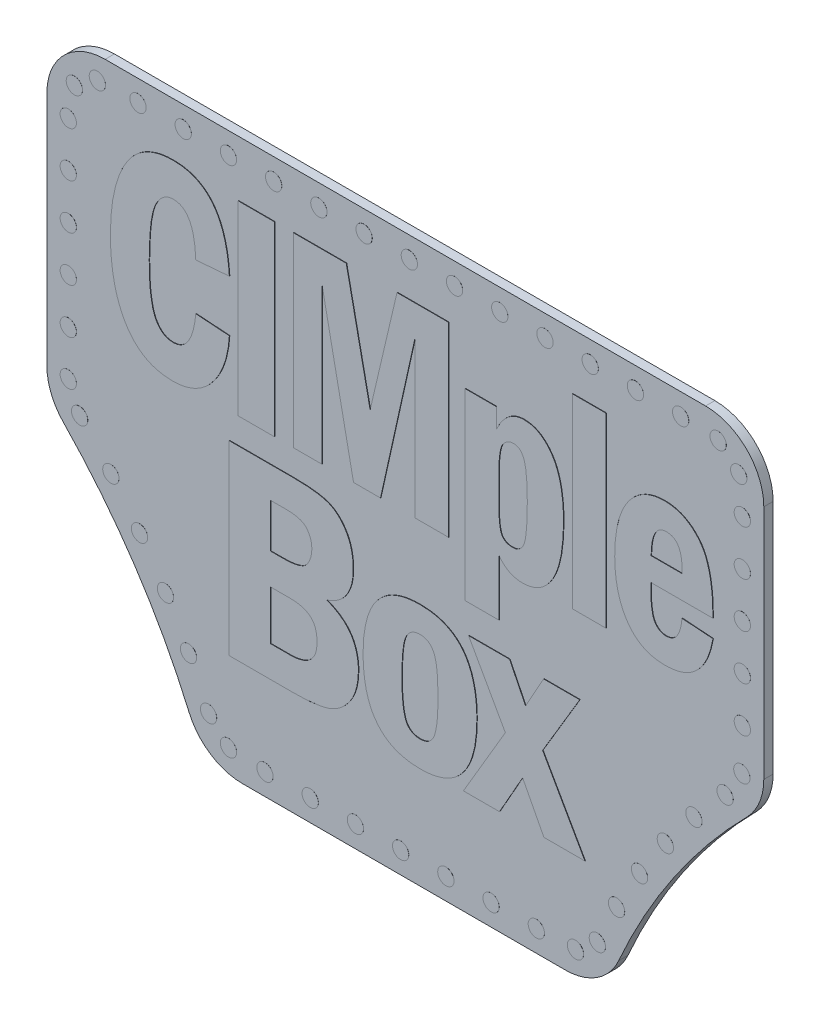
from build123d import *

# Parameters (mm, degrees)
EXTRUDE1_DEPTH        = 0.508
SKETCH2_W             = 1.975555555
SKETCH2_H             = 10.16
SKETCH2_W_2           = 1.834444445
EXTRUDE2_DEPTH        = 0.0254
SKETCH3_R             = 0.4445
EXTRUDE3_DEPTH        = 0.00254
CRVPATTERN1_OUTLINE_R = 0.4445
CRVPATTERN1_DEPTH     = 0.00254


# Read off the part's stored shape, not the designer's step: CrvPattern1
with BuildPart() as part:
    # Sketch1 → Extrude1 (new body)
    with BuildSketch(Plane.XY):
        with BuildLine():
            Line((-8.632624022, 0), (8.987565635, 0))
            ThreePointArc((8.987565635, 0), (10.722169706, 0.515719323), (11.893265848, 1.89533939))
            ThreePointArc((11.893265848, 1.89533939), (14.922939158, 7.361645029), (18.894443063, 12.187261512))
            ThreePointArc((18.894443063, 12.187261512), (19.573665347, 13.212972062), (19.812, 14.419877874))
            Line((19.812, 14.419877874), (19.812, 27.305))
            ThreePointArc((19.812, 27.305), (18.88206403, 29.55006403), (16.637, 30.48))
            Line((16.637, 30.48), (-16.129, 30.48))
            ThreePointArc((-16.129, 30.48), (-18.37406403, 29.55006403), (-19.304, 27.305))
            Line((-19.304, 27.305), (-19.304, 14.400816143))
            ThreePointArc((-19.304, 14.400816143), (-19.071637117, 13.208544447), (-18.408559498, 12.19078594))
            ThreePointArc((-18.408559498, 12.19078594), (-14.511459517, 7.36510419), (-11.54746962, 1.916310149))
            ThreePointArc((-11.54746962, 1.916310149), (-10.376797856, 0.521986122), (-8.632624022, 0))
        make_face()
    extrude(amount=-EXTRUDE1_DEPTH)

    # Sketch2 → Extrude2 (add)
    # profile 1 of 9: a face of its own
    with BuildSketch(Plane.XY):
        with BuildLine():
            Line((-11.156026879, 20.956459834), (-9.321582435, 20.830782751))
            add(Edge.make_bspline(
                [(-9.321582435, 20.830782751), (-9.331412326, 20.69754818), (-9.35066099, 20.436651334), (-9.41157215, 20.056711185), (-9.492894129, 19.695709727), (-9.595952685, 19.352433802), (-9.724017887, 19.028149464), (-9.874083434, 18.722640455), (-10.046923425, 18.435990561), (-10.241972221, 18.171261763), (-10.454399893, 17.929576752), (-10.68789777, 17.720569707), (-10.937902864, 17.544336399), (-11.202688362, 17.395510362), (-11.486287548, 17.283518805), (-11.786852023, 17.204581984), (-12.103159811, 17.154293563), (-12.320000732, 17.149103238), (-12.430436602, 17.146459834)],
                knots=[0, 0, 0, 0, 1.195691685, 2.341375726, 3.441262705, 4.50707975, 5.546965825, 6.559316984, 7.551295691, 8.539710404, 9.499858522, 10.427224074, 11.338290689, 12.233729095, 13.140412579, 14.059806091, 15.011870085, 16, 16, 16, 16], degree=3))
            add(Edge.make_bspline(
                [(-12.430436602, 17.146459834), (-12.564468611, 17.150603296), (-12.825312621, 17.158667021), (-13.204680887, 17.224147115), (-13.559598751, 17.331274468), (-13.889885088, 17.485188814), (-14.193966521, 17.683680851), (-14.474622317, 17.924158667), (-14.728551792, 18.20925881), (-14.958023127, 18.534952245), (-15.160020569, 18.899142689), (-15.332500502, 19.298321801), (-15.484489101, 19.727805077), (-15.603119639, 20.191617644), (-15.699048546, 20.686981713), (-15.762090623, 21.214641004), (-15.806582492, 21.774438985), (-15.810617029, 22.158748259), (-15.812693546, 22.35654664)],
                knots=[0, 0, 0, 0, 0.920952615, 1.792295542, 2.637765337, 3.462818855, 4.288259051, 5.126740183, 5.996147311, 6.905958594, 7.860464272, 8.853661514, 9.89232789, 10.98915205, 12.141589521, 13.35862694, 14.640523792, 16, 16, 16, 16], degree=3))
            add(Edge.make_bspline(
                [(-15.812693546, 22.35654664), (-15.810225829, 22.555780148), (-15.805421802, 22.943637912), (-15.766209736, 23.508348352), (-15.697712185, 24.039770618), (-15.604248473, 24.537889969), (-15.483229133, 25.002996123), (-15.335778804, 25.434485831), (-15.162141375, 25.83382621), (-14.959462759, 26.198137119), (-14.731599273, 26.526421155), (-14.474304843, 26.810846148), (-14.191082796, 27.052692061), (-13.881343713, 27.250595503), (-13.543020402, 27.400469414), (-13.181688315, 27.51249488), (-12.792062291, 27.576094944), (-12.524001462, 27.58441124), (-12.386339379, 27.588682056)],
                knots=[0, 0, 0, 0, 1.357241345, 2.642209119, 3.853882634, 5.005774751, 6.092718463, 7.125116944, 8.109367235, 9.055274503, 9.96098212, 10.825911765, 11.660647654, 12.491288873, 13.320480085, 14.174162664, 15.062345021, 16, 16, 16, 16], degree=3))
            add(Edge.make_bspline(
                [(-12.386339379, 27.588682056), (-12.272253465, 27.585890173), (-12.049710597, 27.580444157), (-11.726013026, 27.533048503), (-11.422462614, 27.456918751), (-11.139049499, 27.347631581), (-10.876055807, 27.207864918), (-10.630228521, 27.040302691), (-10.40924331, 26.835863308), (-10.204925984, 26.604304454), (-10.024862924, 26.339327868), (-9.862426738, 26.045936586), (-9.722350547, 25.720545257), (-9.601860382, 25.364947669), (-9.500213159, 24.978916115), (-9.420189782, 24.562613504), (-9.357548216, 24.115181232), (-9.333831551, 23.806049739), (-9.321582435, 23.64639039)],
                knots=[0, 0, 0, 0, 0.976031221, 1.903905397, 2.79339203, 3.649694687, 4.496704583, 5.337760276, 6.188290118, 7.066471772, 7.975561649, 8.924436454, 9.932988666, 11.003235276, 12.135396989, 13.34688187, 14.629725139, 16, 16, 16, 16], degree=3))
            Line((-9.321582435, 23.64639039), (-11.156026879, 23.496459834))
            add(Edge.make_bspline(
                [(-11.156026879, 23.496459834), (-11.159629712, 23.587647017), (-11.166611484, 23.764354669), (-11.189950781, 24.020097411), (-11.21636016, 24.258953125), (-11.257394048, 24.479279243), (-11.302507064, 24.682834679), (-11.357211285, 24.86874456), (-11.421673611, 25.036277421), (-11.490795579, 25.188478386), (-11.573429217, 25.320258799), (-11.661177082, 25.437756294), (-11.761171487, 25.534454134), (-11.86756979, 25.614928754), (-11.982211781, 25.678636359), (-12.106734278, 25.722175976), (-12.239643026, 25.749384102), (-12.331085633, 25.752603043), (-12.377519935, 25.754237612)],
                knots=[0, 0, 0, 0, 1.53923461, 2.982815419, 4.331538383, 5.591331752, 6.761349047, 7.847985331, 8.856554963, 9.788354872, 10.662351623, 11.475765264, 12.256094253, 13.000014828, 13.721379146, 14.458657439, 15.217310545, 16, 16, 16, 16], degree=3))
            add(Edge.make_bspline(
                [(-12.377519935, 25.754237612), (-12.426948536, 25.752195216), (-12.524021526, 25.748184149), (-12.665971511, 25.71393699), (-12.799138467, 25.655950564), (-12.924152375, 25.574626289), (-13.041667452, 25.472487521), (-13.150529661, 25.346533187), (-13.251338629, 25.198376906), (-13.345491018, 25.025363663), (-13.431197279, 24.819988886), (-13.50142235, 24.574108181), (-13.563152964, 24.286930345), (-13.609100339, 23.957315849), (-13.649155866, 23.586063863), (-13.677380307, 23.171991319), (-13.6913655, 22.715301699), (-13.694428531, 22.396977357), (-13.696026879, 22.230869556)],
                knots=[0, 0, 0, 0, 0.576074696, 1.131354957, 1.692037288, 2.262855602, 2.864584874, 3.502606331, 4.199448514, 4.951497082, 5.797053961, 6.789969737, 7.930188741, 9.221608462, 10.670333167, 12.286148418, 14.062040392, 16, 16, 16, 16], degree=3))
            add(Edge.make_bspline(
                [(-13.696026879, 22.230869556), (-13.695403149, 22.082396271), (-13.694204715, 21.797119883), (-13.67899353, 21.38678737), (-13.652630493, 21.013289032), (-13.618468321, 20.675466303), (-13.572514344, 20.374537057), (-13.518497991, 20.108345253), (-13.454189713, 19.878210852), (-13.375691896, 19.683101545), (-13.289119723, 19.516370438), (-13.191108799, 19.373731009), (-13.084149388, 19.25148688), (-12.964535447, 19.152801992), (-12.836852806, 19.073990439), (-12.696641619, 19.021473529), (-12.547534643, 18.986602713), (-12.443873327, 18.9828351), (-12.390749102, 18.980904279)],
                knots=[0, 0, 0, 0, 1.843245999, 3.541610594, 5.096640905, 6.491232566, 7.755894152, 8.874347529, 9.861991293, 10.717656505, 11.480906099, 12.189571632, 12.861697391, 13.490231358, 14.108346914, 14.714973975, 15.341451411, 16, 16, 16, 16], degree=3))
            add(Edge.make_bspline(
                [(-12.390749102, 18.980904279), (-12.348060253, 18.982959394), (-12.264324434, 18.986990581), (-12.141236725, 19.008106507), (-12.026625088, 19.049669046), (-11.916329736, 19.101044156), (-11.817649393, 19.174956144), (-11.720440062, 19.257372965), (-11.636544323, 19.361645643), (-11.552278775, 19.475659389), (-11.48246437, 19.609736364), (-11.411386106, 19.755243993), (-11.355004554, 19.919157427), (-11.297452543, 20.096072141), (-11.25334066, 20.289751625), (-11.212983264, 20.498493973), (-11.180391, 20.722213789), (-11.164289366, 20.877021102), (-11.156026879, 20.956459834)],
                knots=[0, 0, 0, 0, 0.800326963, 1.569872121, 2.32737979, 3.078481094, 3.838610984, 4.628570735, 5.45876695, 6.337316587, 7.279963859, 8.283752851, 9.368129087, 10.521933679, 11.767361149, 13.084879993, 14.504118226, 16, 16, 16, 16], degree=3))
        make_face()
    # profile 2 of 9: a face of its own
    with BuildSketch(Plane.XY):
        with Locations((-7.85402688, 22.367570945)):
            Rectangle(SKETCH2_W, SKETCH2_H)
    # profile 3 of 9: a face of its own
    with BuildSketch(Plane.XY):
        Polygon((-5.822026879, 27.447570945), (-2.944683129, 27.447570945), (-1.641610213, 21.172536223), (-0.175377574, 27.447570945), (2.644639787, 27.447570945), (2.644639787, 17.287570945), (0.810195343, 17.287570945), (0.810195343, 25.796129973), (-1.074960907, 17.287570945), (-2.547808129, 17.287570945), (-4.269804657, 25.796129973), (-4.269804657, 17.287570945), (-5.822026879, 17.287570945), align=None)
    # profile 4 of 9: a face of its own
    with BuildSketch(Plane.XY):
        with BuildLine():
            Line((3.547750898, 24.766459834), (5.241084232, 24.766459834))
            Line((5.241084232, 24.766459834), (5.241084232, 23.679463306))
            add(Edge.make_bspline(
                [(5.241084232, 23.679463306), (5.28781851, 23.776652955), (5.377071162, 23.962264761), (5.533392537, 24.21498102), (5.707550155, 24.425477767), (5.890057058, 24.604010364), (6.090517137, 24.739848925), (6.30438318, 24.836834476), (6.531448916, 24.895949119), (6.687862825, 24.903671385), (6.766848121, 24.907570945)],
                knots=[0, 0, 0, 0, 1.244046216, 2.375866868, 3.418336747, 4.39013926, 5.312228094, 6.196610958, 7.089331513, 8, 8, 8, 8], degree=3))
            add(Edge.make_bspline(
                [(6.766848121, 24.907570945), (6.841988275, 24.90428718), (6.990493656, 24.897797216), (7.209157284, 24.855549633), (7.41744179, 24.781942851), (7.615665009, 24.679654196), (7.802393382, 24.546562321), (7.981537947, 24.387784722), (8.1492594, 24.198448496), (8.306459156, 23.981029265), (8.449851293, 23.734332899), (8.573313311, 23.455291669), (8.678238543, 23.146805618), (8.764036442, 22.807604491), (8.828737972, 22.438224067), (8.877130823, 22.038646545), (8.90578425, 21.608050901), (8.908545866, 21.310751901), (8.909973121, 21.157102195)],
                knots=[0, 0, 0, 0, 0.751497671, 1.485243787, 2.217515776, 2.953907885, 3.708419021, 4.505006865, 5.343106291, 6.232618374, 7.184451349, 8.191232685, 9.279082342, 10.439644226, 11.686799289, 13.027001507, 14.463498549, 16, 16, 16, 16], degree=3))
            add(Edge.make_bspline(
                [(8.909973121, 21.157102195), (8.908601354, 20.996099043), (8.90594315, 20.684107629), (8.876420442, 20.231665613), (8.830885915, 19.809999615), (8.768356735, 19.41864125), (8.684467336, 19.058554741), (8.583804892, 18.727799484), (8.463613014, 18.427773884), (8.323929675, 18.159512574), (8.170088228, 17.92069298), (7.99700708, 17.715440347), (7.811797296, 17.537927994), (7.607708257, 17.396263404), (7.391897456, 17.281180453), (7.157353863, 17.205204847), (6.910179614, 17.154147501), (6.739187821, 17.149052121), (6.652195343, 17.146459834)],
                knots=[0, 0, 0, 0, 1.503628936, 2.913727532, 4.23279418, 5.46405387, 6.613011309, 7.683492715, 8.690552734, 9.627030169, 10.504777924, 11.338017186, 12.129608399, 12.893324289, 13.65171503, 14.404993247, 15.188536555, 16, 16, 16, 16], degree=3))
            add(Edge.make_bspline(
                [(6.652195343, 17.146459834), (6.589578292, 17.148650389), (6.465785864, 17.152981064), (6.284729107, 17.185213872), (6.110561859, 17.233728255), (5.948876018, 17.313077422), (5.790832708, 17.40317463), (5.64536284, 17.520542199), (5.506539788, 17.655923276), (5.42445804, 17.759168452), (5.382195343, 17.81232789)],
                knots=[0, 0, 0, 0, 1.007669058, 1.99213788, 2.954521408, 3.907545567, 4.883799923, 5.87817738, 6.90750443, 8, 8, 8, 8], degree=3))
            Line((5.382195343, 17.81232789), (5.382195343, 14.747570945))
            Line((5.382195343, 14.747570945), (3.547750898, 14.747570945))
            Line((3.547750898, 14.747570945), (3.547750898, 24.766459834))
        make_face()
        with BuildLine():
            add(Edge.make_bspline(
                [(5.382195343, 20.301616084), (5.382540293, 20.214883676), (5.383198148, 20.049476004), (5.390231913, 19.812802204), (5.399507666, 19.599379504), (5.418801876, 19.409972277), (5.436052576, 19.243882795), (5.46377024, 19.103034069), (5.490608347, 18.984191737), (5.535326734, 18.860634805), (5.616168001, 18.734858983), (5.756962519, 18.629118171), (5.935008969, 18.565655947), (6.065856818, 18.560399246), (6.136257843, 18.557570945)],
                knots=[0, 0, 0, 0, 1.444140227, 2.754124773, 3.942790387, 4.999805453, 5.92424315, 6.721126389, 7.388968976, 7.95045353, 8.904235608, 9.829483008, 10.832180866, 12, 12, 12, 12], degree=3))
            add(Edge.make_bspline(
                [(6.136257843, 18.557570945), (6.200508931, 18.561984973), (6.325978358, 18.570604679), (6.498663542, 18.660388496), (6.640297545, 18.803211378), (6.731594214, 18.964634143), (6.790931871, 19.130497949), (6.82871857, 19.299376951), (6.860011324, 19.506539358), (6.889581061, 19.75126278), (6.907284605, 20.035412556), (6.922463942, 20.358086628), (6.934570355, 20.719718899), (6.934470134, 20.97335287), (6.934417565, 21.10639039)],
                knots=[0, 0, 0, 0, 0.78657144, 1.536015509, 2.336699994, 3.237819403, 3.796585222, 4.504070518, 5.366335136, 6.378692205, 7.541032699, 8.874129467, 10.360400778, 12, 12, 12, 12], degree=3))
            add(Edge.make_bspline(
                [(6.934417565, 21.10639039), (6.934251988, 21.218111312), (6.933934937, 21.432038159), (6.92448057, 21.739287079), (6.911594877, 22.01862975), (6.894879443, 22.270213475), (6.871264841, 22.493198787), (6.840552285, 22.687396317), (6.805665263, 22.853844511), (6.766682218, 22.995173051), (6.71995663, 23.114089695), (6.666526674, 23.215906295), (6.604884521, 23.301862827), (6.536943511, 23.374115537), (6.459085932, 23.428079527), (6.375483895, 23.468929333), (6.282812995, 23.490491827), (6.219401805, 23.494440337), (6.186969648, 23.496459834)],
                knots=[0, 0, 0, 0, 1.967654345, 3.767728394, 5.413553478, 6.89289147, 8.208048921, 9.36151831, 10.354226059, 11.20238309, 11.940351044, 12.60053657, 13.22202248, 13.798757175, 14.337485445, 14.881783714, 15.428079414, 16, 16, 16, 16], degree=3))
            add(Edge.make_bspline(
                [(6.186969648, 23.496459834), (6.132842635, 23.492504862), (6.025141709, 23.484635331), (5.86966665, 23.424520521), (5.731928739, 23.320616201), (5.627887551, 23.207090168), (5.554179476, 23.088800663), (5.511260837, 22.969551462), (5.4670799, 22.828398275), (5.440016042, 22.659035437), (5.411791738, 22.465310843), (5.396236136, 22.245021183), (5.384768886, 21.999484265), (5.383081783, 21.827398296), (5.382195343, 21.736980667)],
                knots=[0, 0, 0, 0, 0.901711381, 1.794208563, 2.733393186, 3.757621153, 4.346327299, 5.045220152, 5.863666539, 6.811056587, 7.89986726, 9.129723171, 10.491895504, 12, 12, 12, 12], degree=3))
            Line((5.382195343, 21.736980667), (5.382195343, 20.301616084))
        make_face(mode=Mode.SUBTRACT)
    # profile 5 of 9: a face of its own
    with BuildSketch(Plane.XY):
        with Locations((10.306973121, 22.367570945)):
            Rectangle(SKETCH2_W_2, SKETCH2_H)
    # profile 6 of 9: a face of its own
    with BuildSketch(Plane.XY):
        with BuildLine():
            Line((17.066195343, 20.674237612), (13.679528676, 20.674237612))
            Line((13.679528676, 20.674237612), (13.679528676, 20.257518862))
            add(Edge.make_bspline(
                [(13.679528676, 20.257518862), (13.680734918, 20.17667015), (13.683049393, 20.021541704), (13.690537789, 19.799342658), (13.707616506, 19.597591606), (13.734626896, 19.417567505), (13.76477987, 19.25758235), (13.800689678, 19.118132557), (13.847196956, 18.999899534), (13.915424427, 18.873900726), (14.016271687, 18.748326895), (14.158522374, 18.638793749), (14.319718739, 18.569413804), (14.434371655, 18.561583415), (14.493122426, 18.557570945)],
                knots=[0, 0, 0, 0, 1.385164646, 2.657784334, 3.807922754, 4.851325762, 5.774807004, 6.596367918, 7.314126876, 7.945152157, 9.046283871, 10.043466225, 10.997427432, 12, 12, 12, 12], degree=3))
            add(Edge.make_bspline(
                [(14.493122426, 18.557570945), (14.555427385, 18.56097051), (14.675826929, 18.567539908), (14.845072622, 18.630749461), (14.992546228, 18.731975757), (15.11326747, 18.877577772), (15.211984447, 19.059922834), (15.291049708, 19.280506023), (15.344097261, 19.541168872), (15.362874496, 19.728128237), (15.37286201, 19.827570945)],
                knots=[0, 0, 0, 0, 0.867721624, 1.676805349, 2.488817599, 3.341082384, 4.292821709, 5.374816986, 6.603678884, 8, 8, 8, 8], degree=3))
            Line((15.37286201, 19.827570945), (17.066195343, 19.710713306))
            add(Edge.make_bspline(
                [(17.066195343, 19.710713306), (17.046805272, 19.606835548), (17.009029317, 19.404459719), (16.93419641, 19.113447575), (16.84522138, 18.842684702), (16.745765583, 18.590772478), (16.627014004, 18.360303634), (16.498416312, 18.148110873), (16.353925871, 17.957167384), (16.196850479, 17.786365348), (16.026044486, 17.634764043), (15.839984679, 17.504543275), (15.640921475, 17.394420055), (15.428700144, 17.302094253), (15.202077405, 17.233181319), (14.962538869, 17.181402541), (14.709115394, 17.153611586), (14.535810956, 17.148886257), (14.446820343, 17.146459834)],
                knots=[0, 0, 0, 0, 1.250536399, 2.436309207, 3.553198005, 4.622596589, 5.638019335, 6.618252048, 7.556030789, 8.467164144, 9.360812378, 10.253782899, 11.149418947, 12.049522035, 12.987784832, 13.94836567, 14.946500163, 16, 16, 16, 16], degree=3))
            add(Edge.make_bspline(
                [(14.446820343, 17.146459834), (14.337849481, 17.149057689), (14.125376112, 17.154123034), (13.817702655, 17.204050163), (13.529453671, 17.283219861), (13.261126692, 17.395381734), (13.014339622, 17.5430008), (12.787719632, 17.720875919), (12.580763257, 17.930248458), (12.396528224, 18.171190564), (12.23392561, 18.439747657), (12.090289974, 18.729986593), (11.97221258, 19.043803429), (11.87198146, 19.376356844), (11.798422815, 19.732248866), (11.743480314, 20.108394073), (11.70990987, 20.506796501), (11.705985358, 20.779270232), (11.703973121, 20.918977195)],
                knots=[0, 0, 0, 0, 0.993005324, 1.936179849, 2.833773026, 3.713805014, 4.5792981, 5.448080421, 6.334292075, 7.256566633, 8.207141322, 9.193247226, 10.205160954, 11.261146598, 12.357410799, 13.515636423, 14.726178525, 16, 16, 16, 16], degree=3))
            add(Edge.make_bspline(
                [(11.703973121, 20.918977195), (11.705700934, 21.076337717), (11.709048244, 21.381193755), (11.745881875, 21.824249388), (11.801178368, 22.239238767), (11.882715998, 22.625313998), (11.985883676, 22.983370651), (12.113134485, 23.311975384), (12.263793631, 23.612963984), (12.437471396, 23.884290933), (12.631514881, 24.124342668), (12.840349236, 24.334784548), (13.066150875, 24.51321119), (13.310475316, 24.656017519), (13.568040717, 24.770826659), (13.842658087, 24.849378032), (14.132601329, 24.899799306), (14.331951181, 24.904946573), (14.433591176, 24.907570945)],
                knots=[0, 0, 0, 0, 1.389638415, 2.692159732, 3.924246757, 5.085438129, 6.174253882, 7.212242111, 8.193545116, 9.142557306, 10.051997956, 10.915001107, 11.756543243, 12.586004537, 13.408629215, 14.240627093, 15.102970726, 16, 16, 16, 16], degree=3))
            add(Edge.make_bspline(
                [(14.433591176, 24.907570945), (14.525662085, 24.905513989), (14.707237221, 24.90145742), (14.972443692, 24.854832646), (15.226478133, 24.784896915), (15.46859539, 24.684828262), (15.698350949, 24.555363044), (15.919284797, 24.401174737), (16.123121736, 24.212937), (16.321135629, 24.001033717), (16.500125785, 23.74753198), (16.654586551, 23.44727826), (16.778925431, 23.097639469), (16.888331024, 22.704716536), (16.966841751, 22.263029855), (17.02597622, 21.775817282), (17.060997854, 21.240661765), (17.064414468, 20.868317968), (17.066195343, 20.674237612)],
                knots=[0, 0, 0, 0, 0.784248181, 1.54663369, 2.288657399, 3.027658164, 3.773903948, 4.533735308, 5.3190844, 6.135209433, 7.002857301, 7.955839187, 9.004713829, 10.161692691, 11.430152634, 12.825406501, 14.34527595, 16, 16, 16, 16], degree=3))
        make_face()
        with BuildLine():
            add(Edge.make_bspline(
                [(15.37286201, 21.944237612), (15.374464207, 21.981715869), (15.377228316, 22.046373273), (15.378811212, 22.111069798), (15.379476593, 22.13826539)],
                knots=[0, 0, 0, 0, 1.159287424, 2, 2, 2, 2], degree=3))
            add(Edge.make_bspline(
                [(15.379476593, 22.13826539), (15.377206411, 22.244218715), (15.372931392, 22.443741245), (15.335016841, 22.721753132), (15.269471986, 22.958346469), (15.178897366, 23.154555192), (15.056207933, 23.308042383), (14.907490452, 23.421404149), (14.72699239, 23.484180491), (14.599420642, 23.492247632), (14.532809926, 23.496459834)],
                knots=[0, 0, 0, 0, 1.407996454, 2.651422361, 3.718243464, 4.662028391, 5.502697203, 6.305741244, 7.115354382, 8, 8, 8, 8], degree=3))
            add(Edge.make_bspline(
                [(14.532809926, 23.496459834), (14.466618965, 23.49228973), (14.338594574, 23.484224051), (14.160775648, 23.406701916), (14.012446475, 23.279612915), (13.895322416, 23.102453337), (13.803614149, 22.880184878), (13.739877404, 22.610142553), (13.701699006, 22.292946582), (13.695870281, 22.065623931), (13.692757843, 21.944237612)],
                knots=[0, 0, 0, 0, 0.802879295, 1.552902855, 2.315222702, 3.152124005, 4.114935003, 5.231046814, 6.521427441, 8, 8, 8, 8], degree=3))
            Line((13.692757843, 21.944237612), (15.37286201, 21.944237612))
        make_face(mode=Mode.SUBTRACT)
    # profile 7 of 9: a face of its own
    with BuildSketch(Plane.XY):
        with BuildLine():
            Line((-9.337447628, 15.871232057), (-5.8692011, 15.871232057))
            add(Edge.make_bspline(
                [(-5.8692011, 15.871232057), (-5.7707101, 15.871000857), (-5.579564085, 15.870552157), (-5.302388902, 15.861643685), (-5.043534834, 15.846690303), (-4.803940695, 15.824233839), (-4.582409425, 15.79858433), (-4.379968654, 15.766034652), (-4.195948347, 15.726314809), (-3.976511881, 15.666342989), (-3.721502374, 15.560063379), (-3.443392771, 15.37331396), (-3.195145619, 15.124841249), (-3.012941431, 14.87834085), (-2.883612619, 14.657088003), (-2.796185132, 14.477883464), (-2.72734196, 14.287125177), (-2.666558317, 14.08808156), (-2.620700554, 13.877898323), (-2.588090889, 13.657644232), (-2.567744091, 13.427893132), (-2.565338019, 13.271743302), (-2.564114295, 13.192325807)],
                knots=[0, 0, 0, 0, 1.195782894, 2.320710885, 3.366627835, 4.343374594, 5.242126999, 6.073929733, 6.831797456, 7.526800406, 8.834451615, 10.165968858, 11.566816957, 13.078475469, 13.874320004, 14.676542559, 15.495368307, 16.333845402, 17.202043231, 18.104376777, 19.035889777, 20, 20, 20, 20], degree=3))
            add(Edge.make_bspline(
                [(-2.564114295, 13.192325807), (-2.567848032, 13.056068828), (-2.575024621, 12.794170285), (-2.643341802, 12.420169125), (-2.758991102, 12.085416794), (-2.915733573, 11.7854296), (-3.124134282, 11.52677434), (-3.378476176, 11.307594638), (-3.677575902, 11.126450774), (-3.900129331, 11.042029762), (-4.014912906, 10.998489001)],
                knots=[0, 0, 0, 0, 1.151433641, 2.213162177, 3.199824118, 4.136810673, 5.060825416, 5.990424639, 6.96354667, 8, 8, 8, 8], degree=3))
            add(Edge.make_bspline(
                [(-4.014912906, 10.998489001), (-3.944760946, 10.972126778), (-3.80718269, 10.920426602), (-3.609945767, 10.830048653), (-3.427175056, 10.727967122), (-3.255995404, 10.618955505), (-3.101767908, 10.495406899), (-2.956790743, 10.366953428), (-2.829670538, 10.223541336), (-2.711117906, 10.074503382), (-2.609980614, 9.912908931), (-2.523776796, 9.741027201), (-2.44896131, 9.560643624), (-2.385997988, 9.370111725), (-2.341758528, 9.16880637), (-2.304810017, 8.958676953), (-2.285777318, 8.738125847), (-2.283202432, 8.587870554), (-2.281892073, 8.511405668)],
                knots=[0, 0, 0, 0, 1.100666644, 2.158568307, 3.183054967, 4.174234843, 5.135324901, 6.083042513, 7.015510354, 7.946289224, 8.877819125, 9.809661779, 10.768019305, 11.744449275, 12.752709164, 13.792777405, 14.876744894, 16, 16, 16, 16], degree=3))
            add(Edge.make_bspline(
                [(-2.281892073, 8.511405668), (-2.282950878, 8.43051082), (-2.285024556, 8.272077591), (-2.30753907, 8.039199168), (-2.345414182, 7.816194051), (-2.395548143, 7.601444555), (-2.461227109, 7.396128695), (-2.544108067, 7.201522287), (-2.637878521, 7.015308293), (-2.784092199, 6.786878987), (-2.988834118, 6.530776539), (-3.266149917, 6.269801907), (-3.574391921, 6.068278519), (-3.855608172, 5.94926277), (-4.096662846, 5.880467388), (-4.295830498, 5.833368696), (-4.513333463, 5.79740095), (-4.748759551, 5.766940708), (-5.001496507, 5.739693858), (-5.273668774, 5.722427701), (-5.563417472, 5.714834047), (-5.762629966, 5.71245308), (-5.864791378, 5.711232057)],
                knots=[0, 0, 0, 0, 0.927474438, 1.816466369, 2.679714315, 3.519942616, 4.343562373, 5.148159532, 5.94352141, 6.731525315, 8.25448849, 9.691805209, 11.080429419, 12.454964953, 13.175092194, 13.954028901, 14.800658392, 15.70183294, 16.676367558, 17.715257588, 18.828323928, 20, 20, 20, 20], degree=3))
            Line((-5.864791378, 5.711232057), (-9.337447628, 5.711232057))
            Line((-9.337447628, 5.711232057), (-9.337447628, 15.871232057))
        make_face()
        with BuildLine():
            Line((-7.07966985, 11.779009835), (-6.389548323, 11.779009835))
            add(Edge.make_bspline(
                [(-6.389548323, 11.779009835), (-6.307195075, 11.780296205), (-6.150370955, 11.782745822), (-5.9273036, 11.800490403), (-5.727934143, 11.827542169), (-5.552898235, 11.869137417), (-5.40133421, 11.922131091), (-5.271561795, 11.983997673), (-5.167419646, 12.062909753), (-5.061900573, 12.18182129), (-4.968086709, 12.349628967), (-4.880988222, 12.560955199), (-4.833012156, 12.788205931), (-4.825633087, 12.943713048), (-4.821892073, 13.022551501)],
                knots=[0, 0, 0, 0, 1.278432856, 2.434501537, 3.47210319, 4.399235933, 5.222057812, 5.961981889, 6.621523798, 7.235573376, 8.417536753, 9.585036403, 10.775670225, 12, 12, 12, 12], degree=3))
            add(Edge.make_bspline(
                [(-4.821892073, 13.022551501), (-4.825600459, 13.095542651), (-4.83291334, 13.239480077), (-4.881531581, 13.449850482), (-4.968389934, 13.646068474), (-5.063784771, 13.800666837), (-5.164055472, 13.913040104), (-5.262739772, 13.983805009), (-5.377072034, 14.046044302), (-5.51231396, 14.093030947), (-5.664523812, 14.13392937), (-5.837788323, 14.157658446), (-6.028985139, 14.177026789), (-6.163120812, 14.17760006), (-6.233003184, 14.177898724)],
                knots=[0, 0, 0, 0, 1.253232623, 2.471355509, 3.680821442, 4.923401092, 5.575265747, 6.251583768, 6.99678126, 7.803135759, 8.702899785, 9.698666141, 10.801044751, 12, 12, 12, 12], degree=3))
            Line((-6.233003184, 14.177898724), (-7.07966985, 14.177898724))
            Line((-7.07966985, 14.177898724), (-7.07966985, 11.779009835))
        make_face(mode=Mode.SUBTRACT)
        with BuildLine():
            Line((-7.07966985, 7.40456539), (-6.025746239, 7.40456539))
            add(Edge.make_bspline(
                [(-6.025746239, 7.40456539), (-5.909258811, 7.407393811), (-5.689695436, 7.41272501), (-5.383524378, 7.477578622), (-5.121241408, 7.579656947), (-4.904479885, 7.72729173), (-4.738840845, 7.922327969), (-4.619929607, 8.157616953), (-4.552690506, 8.435758335), (-4.544174307, 8.633771586), (-4.53966985, 8.738506363)],
                knots=[0, 0, 0, 0, 1.220675731, 2.300812099, 3.26620698, 4.158451887, 5.022684904, 5.923028019, 6.901431105, 8, 8, 8, 8], degree=3))
            add(Edge.make_bspline(
                [(-4.53966985, 8.738506363), (-4.541386394, 8.798035705), (-4.544698144, 8.912886434), (-4.55735392, 9.07875639), (-4.59062556, 9.2291697), (-4.628042039, 9.367765199), (-4.682582914, 9.490849775), (-4.743124756, 9.604328173), (-4.82099277, 9.700299901), (-4.93917795, 9.81282401), (-5.122132237, 9.925453515), (-5.381486292, 10.022570664), (-5.689315461, 10.074784551), (-5.908705018, 10.08188729), (-6.025746239, 10.085676501)],
                knots=[0, 0, 0, 0, 0.923990783, 1.782667368, 2.574090015, 3.310040862, 4.00456755, 4.657828245, 5.298738473, 5.911559807, 7.182793255, 8.597063752, 10.184581722, 12, 12, 12, 12], degree=3))
            Line((-6.025746239, 10.085676501), (-7.07966985, 10.085676501))
            Line((-7.07966985, 10.085676501), (-7.07966985, 7.40456539))
        make_face(mode=Mode.SUBTRACT)
    # profile 8 of 9: a face of its own
    with BuildSketch(Plane.XY):
        with BuildLine():
            add(Edge.make_bspline(
                [(4.180996816, 9.455086224), (4.179468448, 9.29844348), (4.176500213, 8.994228624), (4.136865087, 8.553437618), (4.080383437, 8.141688236), (3.993191832, 7.761818449), (3.886793666, 7.410318326), (3.752359623, 7.090741955), (3.595018784, 6.800616271), (3.413454273, 6.539959373), (3.206158665, 6.310151252), (2.973414481, 6.110862421), (2.716723491, 5.943289044), (2.436214667, 5.805405332), (2.131820348, 5.699418761), (1.802581402, 5.625719945), (1.449816043, 5.578253325), (1.206063284, 5.572879139), (1.080962094, 5.570120946)],
                knots=[0, 0, 0, 0, 1.323068555, 2.569522869, 3.736666237, 4.831878313, 5.859139424, 6.836006844, 7.755844808, 8.643075463, 9.513610989, 10.363638828, 11.224821626, 12.096861968, 12.998321644, 13.941323988, 14.943426037, 16, 16, 16, 16], degree=3))
            add(Edge.make_bspline(
                [(1.080962094, 5.570120946), (0.955114976, 5.572791287), (0.711334693, 5.577964044), (0.357970125, 5.626216132), (0.02788364, 5.699317002), (-0.278481701, 5.805649784), (-0.560829265, 5.941863799), (-0.816080719, 6.112524996), (-1.051033921, 6.308437655), (-1.255627871, 6.541488084), (-1.439589448, 6.800412693), (-1.600308261, 7.089626322), (-1.729870717, 7.41141804), (-1.84197237, 7.760907976), (-1.923047515, 8.142364508), (-1.985786231, 8.552996863), (-2.019512359, 8.99444631), (-2.025043374, 9.298490859), (-2.027892073, 9.455086224)],
                knots=[0, 0, 0, 0, 1.061573292, 2.056389069, 3.004368312, 3.910661874, 4.787283032, 5.642307468, 6.496093537, 7.361494754, 8.251293684, 9.173077686, 10.146448718, 11.174399196, 12.267014273, 13.433741176, 14.678271856, 16, 16, 16, 16], degree=3))
            add(Edge.make_bspline(
                [(-2.027892073, 9.455086224), (-2.025057506, 9.611682034), (-2.01956719, 9.914994899), (-1.985822624, 10.354983813), (-1.922846016, 10.76411199), (-1.841869376, 11.144803992), (-1.730496313, 11.493881256), (-1.599144212, 11.814847015), (-1.44020108, 12.104896486), (-1.25630997, 12.364208909), (-1.050157452, 12.59498763), (-0.816865564, 12.791449432), (-0.560054889, 12.959017076), (-0.278642251, 13.096100131), (0.028265346, 13.201129478), (0.357424011, 13.278850316), (0.711584877, 13.322371847), (0.955168156, 13.328214652), (1.080962094, 13.331232057)],
                knots=[0, 0, 0, 0, 1.323384517, 2.563284096, 3.725332082, 4.819316411, 5.848555103, 6.817410154, 7.745787189, 8.636701204, 9.498567307, 10.35342333, 11.206110811, 12.083830539, 12.991259857, 13.941828051, 14.937096358, 16, 16, 16, 16], degree=3))
            add(Edge.make_bspline(
                [(1.080962094, 13.331232057), (1.20601075, 13.328130962), (1.449567746, 13.322090967), (1.80313002, 13.279348693), (2.131438063, 13.201033568), (2.4363732, 13.096341713), (2.715957829, 12.957595265), (2.97419019, 12.793109093), (3.205290836, 12.593274303), (3.4141287, 12.365739036), (3.595626385, 12.10468427), (3.751192345, 11.813732144), (3.887413541, 11.494982241), (3.993084803, 11.143892017), (4.080180346, 10.764788719), (4.136906756, 10.354541996), (4.176557494, 9.915213854), (4.179485515, 9.611729847), (4.180996816, 9.455086224)],
                knots=[0, 0, 0, 0, 1.057893856, 2.060457578, 3.00604947, 3.908635267, 4.781764978, 5.640631901, 6.491721612, 7.358741951, 8.247080951, 9.173529618, 10.145889212, 11.174433597, 12.271013834, 13.433462417, 14.675278642, 16, 16, 16, 16], degree=3))
        make_face()
        with BuildLine():
            add(Edge.make_bspline(
                [(2.06433015, 9.450676501), (2.063108206, 9.56679951), (2.060772251, 9.788788488), (2.053521659, 10.107223223), (2.035405506, 10.396139984), (2.012106338, 10.655845806), (1.98126106, 10.886084699), (1.945544789, 11.087675478), (1.899078027, 11.259008063), (1.848968323, 11.404663624), (1.787369228, 11.527080126), (1.71869817, 11.633071163), (1.636331378, 11.721000846), (1.546422305, 11.795612044), (1.442570511, 11.849375518), (1.331864852, 11.894065951), (1.208783039, 11.913913466), (1.124360129, 11.918013369), (1.080962094, 11.920120946)],
                knots=[0, 0, 0, 0, 1.882826293, 3.59934427, 5.163204704, 6.575349561, 7.825756796, 8.92884131, 9.891358811, 10.701711813, 11.421106362, 12.108507166, 12.740936201, 13.36806719, 13.991906725, 14.629255721, 15.295361785, 16, 16, 16, 16], degree=3))
            add(Edge.make_bspline(
                [(1.080962094, 11.920120946), (1.038188067, 11.919337905), (0.954826347, 11.917811849), (0.835703701, 11.891961908), (0.72533423, 11.854973203), (0.624927937, 11.80115339), (0.533379444, 11.731995947), (0.452191245, 11.647057407), (0.377313936, 11.54915274), (0.315948217, 11.430693331), (0.259013649, 11.291122504), (0.214583404, 11.121190157), (0.175764236, 10.920815577), (0.142557919, 10.688340127), (0.119875388, 10.424053462), (0.102342362, 10.127761229), (0.091537197, 9.799856729), (0.089722458, 9.57048213), (0.088774594, 9.450676501)],
                knots=[0, 0, 0, 0, 0.690415651, 1.345541677, 1.962106293, 2.568385443, 3.179424349, 3.80992759, 4.463758046, 5.165844664, 5.960552755, 6.897883561, 8.000635664, 9.261530071, 10.694050156, 12.289855262, 14.062138427, 16, 16, 16, 16], degree=3))
            add(Edge.make_bspline(
                [(0.088774594, 9.450676501), (0.088715895, 9.339682559), (0.088602738, 9.125716974), (0.101154157, 8.818514468), (0.115085784, 8.536803154), (0.137953895, 8.282558053), (0.162053404, 8.054007481), (0.198812742, 7.852851454), (0.236321051, 7.676943956), (0.282709846, 7.526025302), (0.338362383, 7.396593378), (0.406353575, 7.28487967), (0.489615373, 7.191580354), (0.582791119, 7.112258569), (0.69019051, 7.052764372), (0.809271509, 7.010187388), (0.941115523, 6.986385316), (1.033095496, 6.982995911), (1.080962094, 6.981232057)],
                knots=[0, 0, 0, 0, 1.788008233, 3.446784741, 4.952855786, 6.331489274, 7.559346489, 8.653392745, 9.624342811, 10.455736078, 11.192728211, 11.889328809, 12.552099418, 13.199459627, 13.851567207, 14.518239912, 15.228888501, 16, 16, 16, 16], degree=3))
            add(Edge.make_bspline(
                [(1.080962094, 6.981232057), (1.126633731, 6.983006427), (1.214979813, 6.986438725), (1.342309874, 7.010561393), (1.45870162, 7.052627871), (1.562960821, 7.112576265), (1.655635054, 7.189217767), (1.734876201, 7.283212863), (1.80417222, 7.392859087), (1.8617096, 7.521481663), (1.90975451, 7.67177858), (1.951446759, 7.847235464), (1.984737176, 8.049326809), (2.017089168, 8.277707241), (2.037505981, 8.533203056), (2.052055227, 8.81555463), (2.06448973, 9.124252822), (2.06438477, 9.338949552), (2.06433015, 9.450676501)],
                knots=[0, 0, 0, 0, 0.739204048, 1.42989797, 2.088595332, 2.733501573, 3.367225861, 4.025385729, 4.715259349, 5.460661282, 6.299695966, 7.266433196, 8.377471231, 9.614224508, 10.999500999, 12.52470913, 14.191478523, 16, 16, 16, 16], degree=3))
        make_face(mode=Mode.SUBTRACT)
    # profile 9 of 9: a face of its own
    with BuildSketch(Plane.XY):
        Polygon((3.729441261, 13.190120946), (5.967375289, 13.190120946), (6.838295427, 11.426232057), (7.826073205, 13.190120946), (9.797219039, 13.190120946), (7.770951677, 9.788020251), (10.079441261, 5.711232057), (7.839302372, 5.711232057), (6.679545427, 7.944756363), (5.418364872, 5.711232057), (3.447219039, 5.711232057), (5.735864872, 9.605016779), align=None)
    extrude(amount=EXTRUDE2_DEPTH)

    # Sketch3 → Extrude3 (add)
    with BuildSketch(Plane.XY):
        with Locations((0, 1.1684)):
            Circle(SKETCH3_R)
    extrude(amount=EXTRUDE3_DEPTH)

    # CrvPattern1 outline → CrvPattern1 (add)
    with BuildSketch(Plane.XY):
        with Locations((2.467464856, 1.1684)):
            Circle(CRVPATTERN1_OUTLINE_R)
        with Locations((4.934929712, 1.1684)):
            Circle(CRVPATTERN1_OUTLINE_R)
        with Locations((7.402394568, 1.1684)):
            Circle(CRVPATTERN1_OUTLINE_R)
        with Locations((9.53802638, 1.245379175)):
            Circle(CRVPATTERN1_OUTLINE_R)
        with Locations((10.733149091, 2.185362713)):
            Circle(CRVPATTERN1_OUTLINE_R)
        with Locations((11.781819165, 4.368823149)):
            Circle(CRVPATTERN1_OUTLINE_R)
        with Locations((13.034791189, 6.590897864)):
            Circle(CRVPATTERN1_OUTLINE_R)
        with Locations((14.444280349, 8.717137559)):
            Circle(CRVPATTERN1_OUTLINE_R)
        with Locations((16.002991375, 10.73653719)):
            Circle(CRVPATTERN1_OUTLINE_R)
        with Locations((17.702856652, 12.638644698)):
            Circle(CRVPATTERN1_OUTLINE_R)
        with Locations((18.617912528, 14.099832384)):
            Circle(CRVPATTERN1_OUTLINE_R)
        with Locations((18.6436, 16.378769616)):
            Circle(CRVPATTERN1_OUTLINE_R)
        with Locations((18.6436, 18.846234472)):
            Circle(CRVPATTERN1_OUTLINE_R)
        with Locations((18.6436, 21.313699328)):
            Circle(CRVPATTERN1_OUTLINE_R)
        with Locations((18.6436, 23.781164184)):
            Circle(CRVPATTERN1_OUTLINE_R)
        with Locations((18.6436, 26.24862904)):
            Circle(CRVPATTERN1_OUTLINE_R)
        with Locations((18.448662824, 28.167740616)):
            Circle(CRVPATTERN1_OUTLINE_R)
        with Locations((17.323556256, 29.190493057)):
            Circle(CRVPATTERN1_OUTLINE_R)
        with Locations((15.278254729, 29.3116)):
            Circle(CRVPATTERN1_OUTLINE_R)
        with Locations((12.810789873, 29.3116)):
            Circle(CRVPATTERN1_OUTLINE_R)
        with Locations((10.343325016, 29.3116)):
            Circle(CRVPATTERN1_OUTLINE_R)
        with Locations((7.87586016, 29.3116)):
            Circle(CRVPATTERN1_OUTLINE_R)
        with Locations((5.408395304, 29.3116)):
            Circle(CRVPATTERN1_OUTLINE_R)
        with Locations((2.940930448, 29.3116)):
            Circle(CRVPATTERN1_OUTLINE_R)
        with Locations((0.473465592, 29.3116)):
            Circle(CRVPATTERN1_OUTLINE_R)
        with Locations((-1.993999264, 29.3116)):
            Circle(CRVPATTERN1_OUTLINE_R)
        with Locations((-4.46146412, 29.3116)):
            Circle(CRVPATTERN1_OUTLINE_R)
        with Locations((-6.928928977, 29.3116)):
            Circle(CRVPATTERN1_OUTLINE_R)
        with Locations((-9.396393833, 29.3116)):
            Circle(CRVPATTERN1_OUTLINE_R)
        with Locations((-11.863858689, 29.3116)):
            Circle(CRVPATTERN1_OUTLINE_R)
        with Locations((-14.331323545, 29.3116)):
            Circle(CRVPATTERN1_OUTLINE_R)
        with Locations((-16.549173526, 29.267115636)):
            Circle(CRVPATTERN1_OUTLINE_R)
        with Locations((-17.804487235, 28.409167598)):
            Circle(CRVPATTERN1_OUTLINE_R)
        with Locations((-18.1356, 26.687560224)):
            Circle(CRVPATTERN1_OUTLINE_R)
        with Locations((-18.1356, 24.220095368)):
            Circle(CRVPATTERN1_OUTLINE_R)
        with Locations((-18.1356, 21.752630512)):
            Circle(CRVPATTERN1_OUTLINE_R)
        with Locations((-18.1356, 19.285165656)):
            Circle(CRVPATTERN1_OUTLINE_R)
        with Locations((-18.1356, 16.8177008)):
            Circle(CRVPATTERN1_OUTLINE_R)
        with Locations((-18.135345378, 14.368850809)):
            Circle(CRVPATTERN1_OUTLINE_R)
        with Locations((-17.516783462, 12.949397442)):
            Circle(CRVPATTERN1_OUTLINE_R)
        with Locations((-15.812209545, 11.051508433)):
            Circle(CRVPATTERN1_OUTLINE_R)
        with Locations((-14.248498769, 9.035977847)):
            Circle(CRVPATTERN1_OUTLINE_R)
        with Locations((-12.833744626, 6.91323772)):
            Circle(CRVPATTERN1_OUTLINE_R)
        with Locations((-11.575269637, 4.694274981)):
            Circle(CRVPATTERN1_OUTLINE_R)
        with Locations((-10.479587448, 2.390574594)):
            Circle(CRVPATTERN1_OUTLINE_R)
        with Locations((-9.394916982, 1.318833789)):
            Circle(CRVPATTERN1_OUTLINE_R)
        with Locations((-7.402394568, 1.1684)):
            Circle(CRVPATTERN1_OUTLINE_R)
        with Locations((-4.934929712, 1.1684)):
            Circle(CRVPATTERN1_OUTLINE_R)
        with Locations((-2.467464856, 1.1684)):
            Circle(CRVPATTERN1_OUTLINE_R)
    extrude(amount=CRVPATTERN1_DEPTH)


solid = part.part
